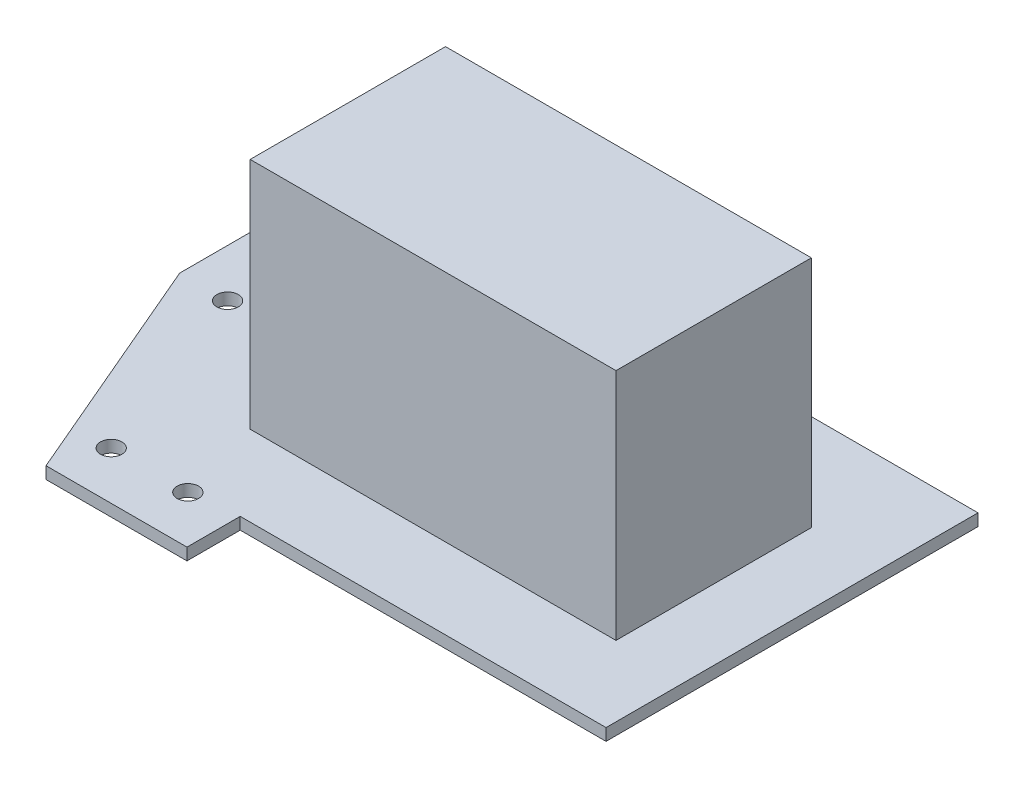
from build123d import *

# Parameters (mm, degrees)
BOSS_EXTRUDE1_DEPTH = 1.5875
SKETCH2_W           = 36.068
SKETCH2_H           = 1.5875
BOSS_EXTRUDE2_DEPTH = 21.2725
SKETCH3_W           = 1.5875
SKETCH3_H           = 25.654
BOSS_EXTRUDE3_DEPTH = 6.35
FILLET1_R           = 3.175
HOLE1_D             = 5.08
HOLE1_DEPTH         = 15.875
HOLE2_D             = 2.8448
SKETCH9_W           = 48.514
SKETCH9_H           = 25.908
BOSS_EXTRUDE4_DEPTH = 30.988
HOLE3_D             = 2.8448
LPATTERN1_COUNT     = 2
LPATTERN1_PITCH     = 10.16
SKETCH12_W          = 1.4224
SKETCH12_H          = 36.3855
LPATTERN2_COUNT     = 2
LPATTERN2_PITCH     = 28.575


with BuildPart() as part:
    # Sketch1 → Boss-Extrude1 (new body)
    with BuildSketch(Plane(origin=(0, 0, 0), x_dir=(1, 0, 0), z_dir=(0, 1, 0))):
        Polygon((0, 0), (0, -25.4), (13.2588, -56.388), (31.9532, -56.388), (31.9532, -49.3268), (80.4672, -49.3268), (80.4672, 0), align=None)
    extrude(amount=BOSS_EXTRUDE1_DEPTH)

    # Sketch2 → Boss-Extrude2 (add)
    with BuildSketch(Plane.XZ):
        with Locations((18.034, 0.79375)):
            Rectangle(SKETCH2_W, SKETCH2_H)
    extrude(amount=BOSS_EXTRUDE2_DEPTH)

    # Sketch3 → Boss-Extrude3 (add)
    with BuildSketch(Plane.XY.offset(1.5875)):
        with Locations((35.27425, -21.971)):
            Rectangle(SKETCH3_W, SKETCH3_H)
        with Locations((0.79375, -21.971)):
            Rectangle(SKETCH3_W, SKETCH3_H)
    extrude(amount=BOSS_EXTRUDE3_DEPTH)

    # Fillet1
    # the kernel refuses this fillet: 3.175 mm, written as the material it adds along each edge
    with BuildSketch(Plane(origin=(34.4805, -21.2725, 1.5875), x_dir=(0, 0, -1), z_dir=(1, 0, 0)), Plane(origin=(0, -21.2725, 1.5875), x_dir=(0, 0, -1), z_dir=(1, 0, 0))) as fillet1_piece_1:
        with BuildLine():
            CenterArc((3.175, -2.749630657), FILLET1_R, 120, 60)
            Line((0, -2.749630657), (0, 0))
            Line((0, 0), (1.5875, 0))
        make_face()
    extrude(amount=1.5875)
    # the kernel refuses this fillet: 3.175 mm, written as the material it takes off along each edge
    with BuildSketch(Plane(origin=(26.543, -34.798, 1.5875), x_dir=(0, 1, 0), z_dir=(1, 0, 0)), Plane(origin=(44.0055, -9.144, 7.9375), x_dir=(0, 0, -1), z_dir=(-1, 0, 0)), Plane(origin=(9.525, -34.798, 1.5875), x_dir=(0, 0, 1), z_dir=(-1, 0, 0)), Plane(origin=(9.525, -34.798, 7.9375), x_dir=(0, 1, 0), z_dir=(-1, 0, 0))) as fillet1_2_piece_1:
        with BuildLine():
            CenterArc((FILLET1_R, FILLET1_R), FILLET1_R, 180, 90)
            Line((0, FILLET1_R), (0, 0))
            Line((0, 0), (FILLET1_R, 0))
        make_face()
    extrude(amount=17.4625, mode=Mode.SUBTRACT)
    with BuildSketch(Plane(origin=(26.543, -34.798, 7.9375), x_dir=(0, 1, 0), z_dir=(1, 0, 0)), Plane(origin=(-7.9375, -9.144, 7.9375), x_dir=(0, 0, -1), z_dir=(1, 0, 0))) as fillet1_2_piece_2:
        with BuildLine():
            CenterArc((FILLET1_R, -FILLET1_R), FILLET1_R, 90, 90)
            Line((0, -FILLET1_R), (0, 0))
            Line((0, 0), (FILLET1_R, 0))
        make_face()
    extrude(amount=17.4625, mode=Mode.SUBTRACT)

    # Hole1
    with Locations(Plane(origin=(0, 0, 0), x_dir=(-1, 0, 0), z_dir=(0, 0, -1))):
        with Locations((-18.034, -9.8425)):
            Hole(HOLE1_D / 2, depth=HOLE1_DEPTH)

    # Hole2 (through all)
    with Locations(Plane(origin=(36.068, 3.937526914, -1.455484635), x_dir=(0, 0, -1), z_dir=(1, 0, 0))):
        with Locations((-6.217984635, -32.050026914)):
            Hole(HOLE2_D / 2)

    # Sketch9 → Boss-Extrude4 (add)
    with BuildSketch(Plane(origin=(0, 1.5875, 0), x_dir=(1, 0, 0), z_dir=(0, 1, 0))):
        with Locations((46.863, -25.7048)):
            Rectangle(SKETCH9_W, SKETCH9_H)
    extrude(amount=BOSS_EXTRUDE4_DEPTH)

    # Hole3 (through all)
    with Locations(Plane(origin=(0, 1.5875, 0), x_dir=(-1, 0, 0), z_dir=(0, 1, 0))):
        with Locations((-25.7175, 50.038)):
            hole3 = Hole(HOLE3_D / 2)

    # LPattern1: Hole3 ×2
    with Locations(*[(-i * LPATTERN1_PITCH, 0, 0) for i in range(1, LPATTERN1_COUNT)]):
        add(hole3, mode=Mode.SUBTRACT)

    # Sketch12 → Hole4 (revolve, cut)
    with BuildSketch(Plane(origin=(6.35, 1.5875, 25.4), x_dir=(0, 0, 1), z_dir=(1, 0, 0))):
        with Locations((0.7112, 18.19275)):
            Rectangle(SKETCH12_W, SKETCH12_H)
    hole4 = revolve(axis=Axis((6.35, -108.4125, 25.4), (0, 1, 0)), mode=Mode.SUBTRACT)

    # LPattern2: Hole4 ×2
    with Locations(*[(i * LPATTERN2_PITCH, 0, 0) for i in range(1, LPATTERN2_COUNT)]):
        add(hole4, mode=Mode.SUBTRACT)


solid = part.part
